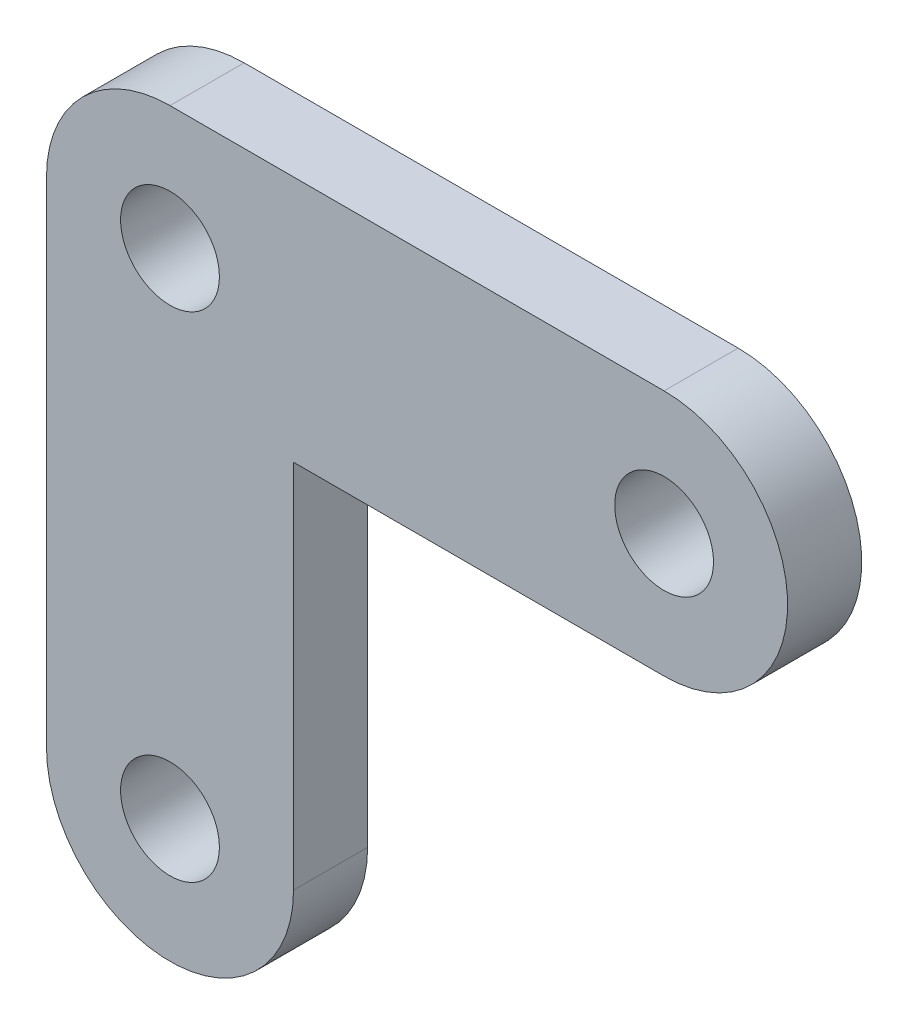
from build123d import *

# Parameters (mm, degrees)
SKETCH1_R           = 2
BOSS_EXTRUDE1_DEPTH = 3


with BuildPart() as part:
    # Sketch1 → Boss-Extrude1 (new body)
    with BuildSketch(Plane.XY):
        with BuildLine():
            Line((4.001181793, 31.666122725), (4.001181793, 11.666122725))
            ThreePointArc((4.001181793, 11.666122725), (9.001181793, 6.666122725), (14.001181793, 11.666122725))
            Line((14.001181793, 11.666122725), (14.001181793, 26.666122725))
            Line((14.001181793, 26.666122725), (29.001181793, 26.666122725))
            ThreePointArc((29.001181793, 26.666122725), (34.001181793, 31.666122725), (29.001181793, 36.666122725))
            Line((29.001181793, 36.666122725), (9.001181793, 36.666122725))
            ThreePointArc((9.001181793, 36.666122725), (5.465647887, 35.201656631), (4.001181793, 31.666122725))
        make_face()
        with Locations((9.001181793, 31.666122725)):
            Circle(SKETCH1_R, mode=Mode.SUBTRACT)
        with Locations((9.001181793, 11.666122725)):
            Circle(SKETCH1_R, mode=Mode.SUBTRACT)
        with Locations((29.001181793, 31.666122725)):
            Circle(SKETCH1_R, mode=Mode.SUBTRACT)
    extrude(amount=BOSS_EXTRUDE1_DEPTH)


solid = part.part
